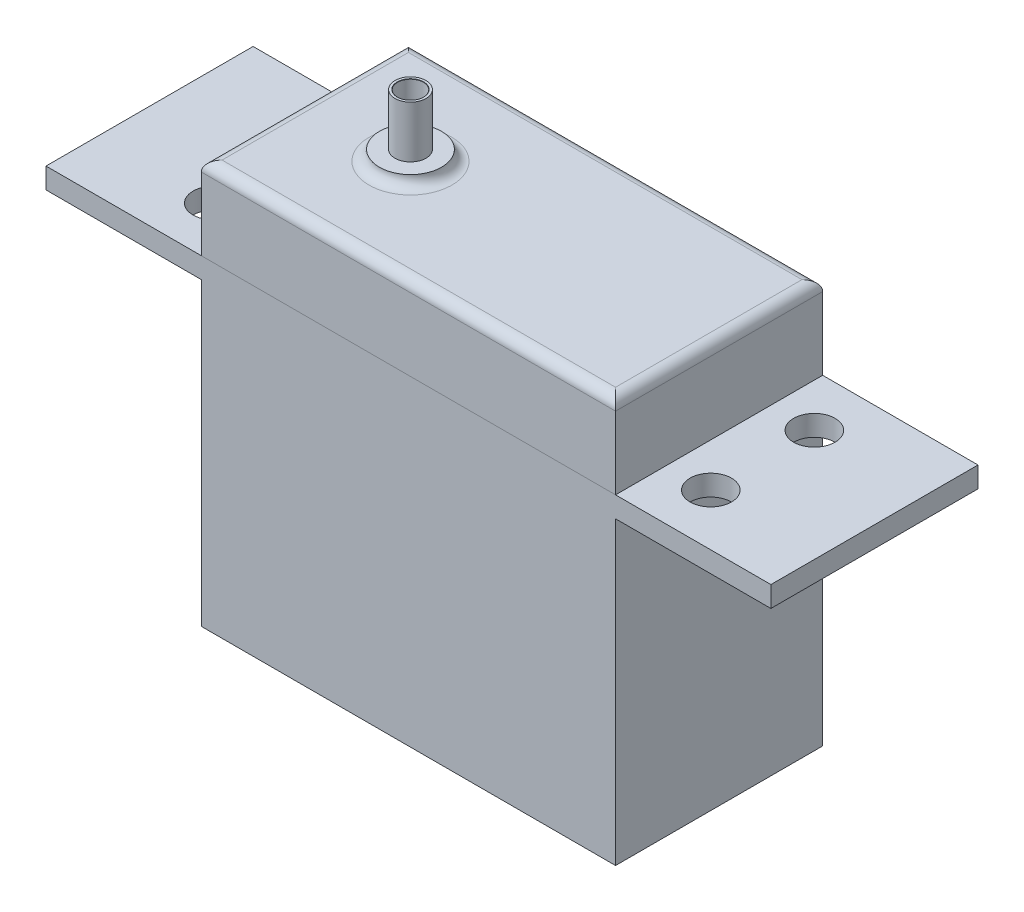
from build123d import *

# Parameters (mm, degrees)
SKETCH_1_W                   = 40
SKETCH_1_H                   = 39
EXTRUDE_1_DEPTH              = 20
SKETCH_2_W                   = 20
SKETCH_2_H                   = 2
EXTRUDE_2_DEPTH              = 15
SKETCH_6_W                   = 20
SKETCH_6_H                   = 2
EXTRUDE_3_DEPTH              = 15
SKETCH_8_R                   = 2
CUT_EXTRUDE_1_DEPTH          = 6
SKETCH_11_R                  = 3
EXTRUDE_5_DEPTH              = 1
SKETCH_16_R                  = 1.5
EXTRUDE_7_DEPTH              = 5
HOLE_WIZARD_M3_3_D           = 2.5
HOLE_WIZARD_M3_3_DEPTH       = 3
HOLE_WIZARD_M3_3_CSINK_D     = 2.55
HOLE_WIZARD_M3_3_CSINK_ANGLE = 90
HOLE_WIZARD_M3_3_TIP         = 0.751075774
FILLET_4_R                   = 1


with BuildPart() as part:
    # 草图1 → 凸台-拉伸1 (new body)
    with BuildSketch(Plane.XY):
        Rectangle(SKETCH_1_W, SKETCH_1_H)
    extrude(amount=EXTRUDE_1_DEPTH)

    # 草图2 → 凸台-拉伸2 (add)
    with BuildSketch(Plane.ZY.offset(20)):
        with Locations((10, 10.5)):
            Rectangle(SKETCH_2_W, SKETCH_2_H)
    extrude(amount=EXTRUDE_2_DEPTH)

    # 草图6 → 凸台-拉伸3 (add)
    with BuildSketch(Plane(origin=(20, 0, 0), x_dir=(0, 0, -1), z_dir=(1, 0, 0))):
        with Locations((-10, 10.5)):
            Rectangle(SKETCH_6_W, SKETCH_6_H)
    extrude(amount=EXTRUDE_3_DEPTH)

    # 草图8 → 切除-拉伸1 (cut)
    with BuildSketch(Plane(origin=(0, 11.5, 0), x_dir=(1, 0, 0), z_dir=(0, 1, 0))):
        with Locations(Location((-23.804244171, -5, 0), (0, 0, 270))):
            Circle(SKETCH_8_R)
        with Locations(Location((-23.804244171, -15, 0), (0, 0, 270))):
            Circle(SKETCH_8_R)
        with Locations(Location((24.195755829, -5, 0), (0, 0, 270))):
            Circle(SKETCH_8_R)
        with Locations(Location((24.195755829, -15, 0), (0, 0, 180))):
            Circle(SKETCH_8_R)
    extrude(amount=-CUT_EXTRUDE_1_DEPTH, mode=Mode.SUBTRACT)

    # 草图11 → 凸台-拉伸5 (add)
    with BuildSketch(Plane(origin=(0, 19.5, 0), x_dir=(1, 0, 0), z_dir=(0, 1, 0))):
        with Locations(Location((-9.804244171, -10, 0), (0, 0, 90))):
            Circle(SKETCH_11_R)
    extrude(amount=EXTRUDE_5_DEPTH)

    # 草图16 → 凸台-拉伸7 (add)
    with BuildSketch(Plane(origin=(0, 20.5, 0), x_dir=(1, 0, 0), z_dir=(0, 1, 0))):
        with Locations(Location((-9.804244171, -10, 0), (0, 0, 270))):
            Circle(SKETCH_16_R)
    extrude(amount=EXTRUDE_7_DEPTH)

    # M3 螺纹孔的螺纹孔钻头3
    with Locations(Plane(origin=(0, 25.5, 0), x_dir=(1, 0, 0), z_dir=(0, 1, 0))):
        with Locations((-9.804244171, -10)):
            CounterSinkHole(HOLE_WIZARD_M3_3_D / 2, HOLE_WIZARD_M3_3_CSINK_D / 2, depth=HOLE_WIZARD_M3_3_DEPTH, counter_sink_angle=HOLE_WIZARD_M3_3_CSINK_ANGLE)
            with Locations((0, 0, -(HOLE_WIZARD_M3_3_DEPTH + HOLE_WIZARD_M3_3_TIP / 2))):  # 118° drill point
                Cone(0, HOLE_WIZARD_M3_3_D / 2, HOLE_WIZARD_M3_3_TIP, mode=Mode.SUBTRACT)

    # 圆角4
    fillet_4_edges = [part.edges().sort_by_distance(p)[0] for p in [
        (0, 19.5, 0),
        (-9.804244171, 19.5, 13),
        (-20, 19.5, 10),
        (20, 19.5, 10),
        (0, 19.5, 20),
    ]]
    fillet(fillet_4_edges, radius=FILLET_4_R - 0.0001)  # a hair under: the kernel refuses the full size


solid = part.part
